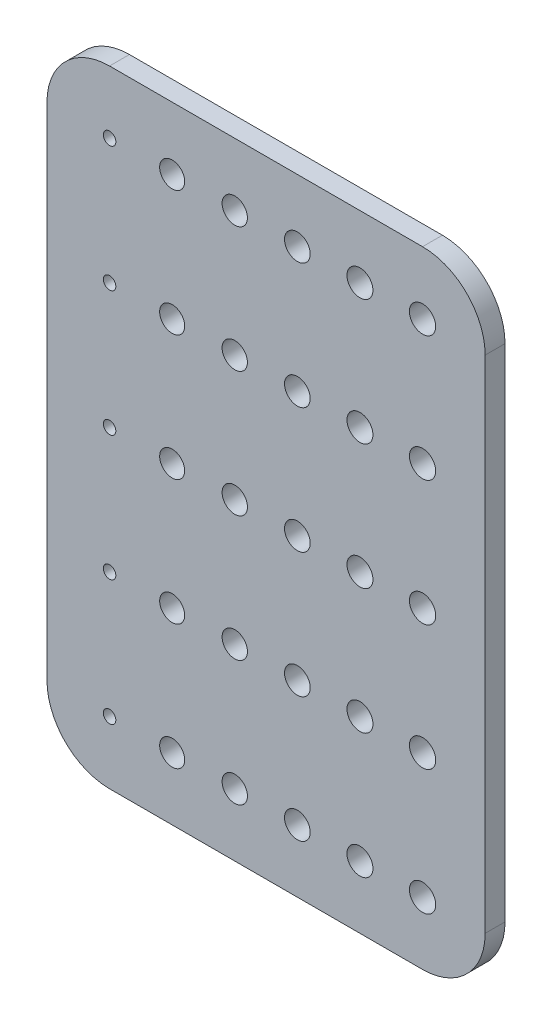
from build123d import *

# Parameters (mm, degrees)
SKETCH1_W           = 70
SKETCH1_H           = 20
SKETCH1_R           = 2
SKETCH1_R_2         = 2.025
SKETCH1_R_3         = 2.05
SKETCH1_R_4         = 2.1
SKETCH1_R_5         = 2.075
SKETCH1_R_6         = 1
BOSS_EXTRUDE1_DEPTH = 3.175
LPATTERN1_COUNT     = 5
LPATTERN1_PITCH     = 20
FILLET1_R           = 10


with BuildPart() as part:
    # Sketch1 → Boss-Extrude1 (new body)
    with BuildSketch(Plane.XY):
        with Locations((15, 0)):
            Rectangle(SKETCH1_W, SKETCH1_H)
        Circle(SKETCH1_R, mode=Mode.SUBTRACT)
        with Locations((10, 0)):
            Circle(SKETCH1_R_2, mode=Mode.SUBTRACT)
        with Locations((20, 0)):
            Circle(SKETCH1_R_3, mode=Mode.SUBTRACT)
        with Locations((40, 0)):
            Circle(SKETCH1_R_4, mode=Mode.SUBTRACT)
        with Locations((30, 0)):
            Circle(SKETCH1_R_5, mode=Mode.SUBTRACT)
        with Locations((-10, 0)):
            Circle(SKETCH1_R_6, mode=Mode.SUBTRACT)
    boss_extrude1 = extrude(amount=BOSS_EXTRUDE1_DEPTH)

    # LPattern1: Boss-Extrude1 ×5
    with Locations(*[(0, -i * LPATTERN1_PITCH, 0) for i in range(1, LPATTERN1_COUNT)]):
        add(boss_extrude1)

    # Fillet1
    fillet1_edges = [part.edges().sort_by_distance(p)[0] for p in [
        (50, 10, 1.5875),
        (-20, 10, 1.5875),
        (50, -90, 1.5875),
        (-20, -90, 1.5875),
    ]]
    fillet(fillet1_edges, radius=FILLET1_R)


solid = part.part
